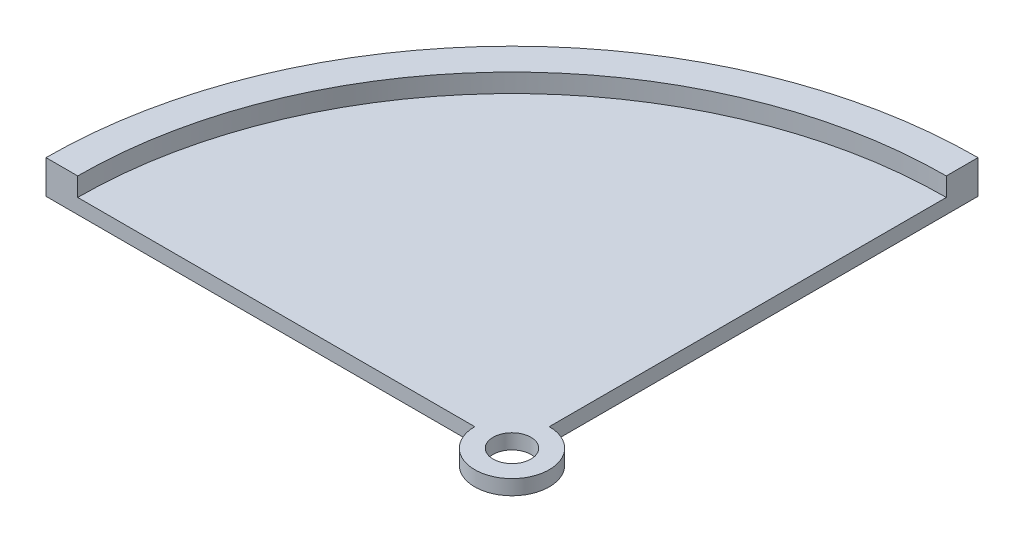
from build123d import *

# Parameters (mm, degrees)
SKETCH1_W           = 125
SKETCH1_H           = 125
BOSS_EXTRUDE1_DEPTH = 4
BOSS_EXTRUDE2_DEPTH = 5
SKETCH3_R           = 10
BOSS_EXTRUDE3_DEPTH = 4
SKETCH4_R           = 5.075
CUT_EXTRUDE1_DEPTH  = 4
FILLET1_R           = 125


with BuildPart() as part:
    # Sketch1 → Boss-Extrude1 (new body)
    with BuildSketch(Plane(origin=(0, 0, 0), x_dir=(1, 0, 0), z_dir=(0, 1, 0))):
        Rectangle(SKETCH1_W, SKETCH1_H)
    extrude(amount=BOSS_EXTRUDE1_DEPTH)

    # Sketch2 → Boss-Extrude2 (add)
    with BuildSketch(Plane(origin=(0, 4, 0), x_dir=(1, 0, 0), z_dir=(0, 1, 0))):
        with BuildLine():
            Line((-62.5, -62.5), (-62.5, 62.5))
            Line((-62.5, 62.5), (62.5, 62.5))
            Line((62.5, 62.5), (62.5, 54))
            ThreePointArc((62.5, 54), (-19.877940008, 19.877940008), (-54, -62.5))
            Line((-54, -62.5), (-62.5, -62.5))
        make_face()
    extrude(amount=BOSS_EXTRUDE2_DEPTH)

    # Sketch3 → Boss-Extrude3 (add)
    with BuildSketch(Plane(origin=(0, 4, 0), x_dir=(1, 0, 0), z_dir=(0, 1, 0))):
        with Locations((62.5, -62.5)):
            Circle(SKETCH3_R)
    extrude(amount=-BOSS_EXTRUDE3_DEPTH)

    # Sketch4 → Cut-Extrude1 (cut)
    with BuildSketch(Plane(origin=(0, 4, 0), x_dir=(1, 0, 0), z_dir=(0, 1, 0))):
        with Locations(Location((62.5, -62.5, 0), (0, 0, 270))):
            Circle(SKETCH4_R)
    extrude(amount=-CUT_EXTRUDE1_DEPTH, mode=Mode.SUBTRACT)

    # Fillet1
    fillet1_edges = [part.edges().sort_by_distance(p)[0] for p in [
        (-62.5, 4.5, -62.5),
    ]]
    fillet(fillet1_edges, radius=FILLET1_R - 0.0001)  # a hair under: the kernel refuses the full size


solid = part.part
